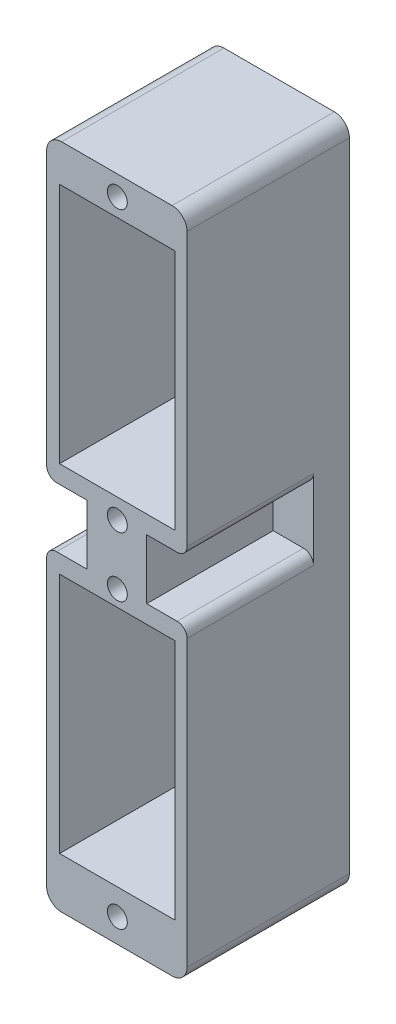
from build123d import *

# Parameters (mm, degrees)
SKETCH4_W           = 14.1
SKETCH4_H           = 67
BOSS_EXTRUDE1_DEPTH = 16.3
FILLET1_R           = 1.5
SKETCH5_W           = 11.6
SKETCH5_H           = 24.3
CUT_EXTRUDE1_DEPTH  = 16.3
SKETCH6_W           = 4.05
SKETCH6_H           = 6
CUT_EXTRUDE2_DEPTH  = 12.7
FILLET2_R           = 1
SKETCH7_R           = 1
CUT_EXTRUDE3_DEPTH  = 16.3


with BuildPart() as part:
    # Sketch4 → Boss-Extrude1 (new body)
    with BuildSketch(Plane.XY.offset(30)):
        with Locations((-182.786990356, 242.047210693)):
            Rectangle(SKETCH4_W, SKETCH4_H)
    extrude(amount=BOSS_EXTRUDE1_DEPTH)

    # Fillet1
    fillet1_edges = [part.edges().sort_by_distance(p)[0] for p in [
        (-189.836990356, 275.547210693, 38.15),
        (-175.736990356, 275.547210693, 38.15),
        (-189.836990356, 208.547210693, 38.15),
        (-175.736990356, 208.547210693, 38.15),
    ]]
    fillet(fillet1_edges, radius=FILLET1_R)

    # Sketch5 → Cut-Extrude1 (cut)
    with BuildSketch(Plane.XY.offset(46.3)):
        with Locations((-182.736990356, 259.597210693)):
            Rectangle(SKETCH5_W, SKETCH5_H)
        with Locations((-182.736990356, 225.697210693)):
            Rectangle(SKETCH5_W, SKETCH5_H)
    extrude(amount=-CUT_EXTRUDE1_DEPTH, mode=Mode.SUBTRACT)

    # Sketch6 → Cut-Extrude2 (cut)
    with BuildSketch(Plane.XY.offset(46.3)):
        with Locations((-187.811990356, 242.647210693)):
            Rectangle(SKETCH6_W, SKETCH6_H)
        with Locations((-177.761990356, 242.647210693)):
            Rectangle(SKETCH6_W, SKETCH6_H)
    extrude(amount=-CUT_EXTRUDE2_DEPTH, mode=Mode.SUBTRACT)

    # Fillet2
    fillet2_edges = [part.edges().sort_by_distance(p)[0] for p in [
        (-175.736990356, 239.647210693, 39.95),
        (-175.736990356, 245.647210693, 39.95),
        (-189.836990356, 239.647210693, 39.95),
        (-189.836990356, 245.647210693, 39.95),
    ]]
    fillet(fillet2_edges, radius=FILLET2_R)

    # Sketch7 → Cut-Extrude3 (cut)
    with BuildSketch(Plane.XY.offset(46.3)):
        with Locations((-182.736990356, 273.547210693)):
            Circle(SKETCH7_R)
        with Locations((-182.736990356, 210.947210693)):
            Circle(SKETCH7_R)
        with Locations((-182.736990356, 245.447210693)):
            Circle(SKETCH7_R)
        with Locations((-182.736990356, 239.447210693)):
            Circle(SKETCH7_R)
    extrude(amount=-CUT_EXTRUDE3_DEPTH, mode=Mode.SUBTRACT)


solid = part.part
